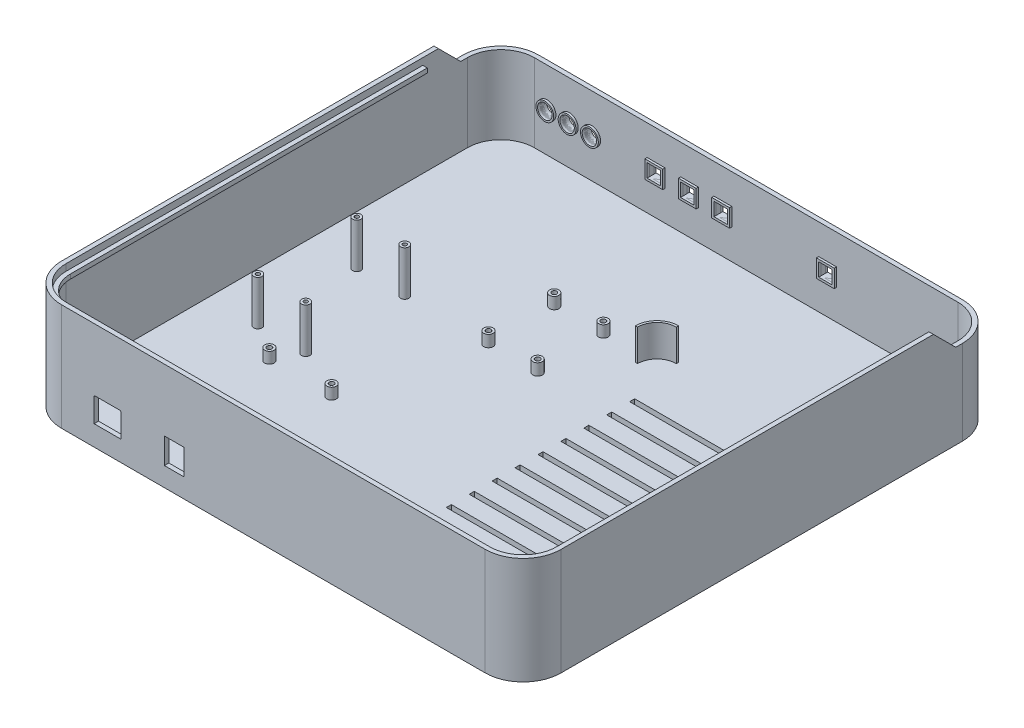
from build123d import *

# Parameters (mm, degrees)
BOSS_EXTRU_1_DEPTH                = 45
BOSS_EXTRU_1_DEPTH_BACK           = 5
COQUE2_START                      = -121.931407942
COQUE2_OUTLINE_W                  = 220
COQUE2_OUTLINE_H                  = 50
COQUE2_DEPTH                      = 180
COQUE2_2_DEPTH                    = 180
COQUE2_START_2                    = -5
COQUE2_3_DEPTH                    = 50
COQUE2_START_3                    = -6
COQUE2_4_DEPTH                    = 51
COQUE2_5_DEPTH                    = 1
FIXATIONS_BATTERIE_12V_DEPTH      = 14.2
FIXATIONS_BATTERIE_12V_2_DEPTH    = 14.2
MODULE_WIFI_R                     = 1.875
MODULE_WIFI_R_2                   = 1.375
MODULE_WIFI_R_3                   = 0.875
INSERTS_MODULE_WIFI_DEPTH         = 20
RELAI_5V_R                        = 1.6
RELAI_5V_R_2                      = 1.102718953
INSERTS_RELAI_DEPTH               = 5.2
BATTERY_9V_R                      = 1.167497876
BATTERY_9V_R_2                    = 0.679581055
BATTERY_9V_R_3                    = 0.194582979
INSERTS_BATTERIE_9V_DEPTH         = 4.5
ARDUINO_SKETCH_R                  = 2.1
ARDUINO_SKETCH_R_2                = 1.6
ARDUINO_SKETCH_R_3                = 1.100535431
ARDUINO_SKETCH_R_4                = 1.1
ARDUINO_SKETCH_R_5                = 1.097252716
ARDUINO_SKETCH_R_6                = 1.102873252
INSERTS_ARDUINO_DEPTH             = 5
EXTRUSION_DEL_ARRIERE_DEPTH       = 5
ESQUISSE21_R                      = 3.25
ENLEVEMENT_DE_MATIERE_LED_DEPTH   = 2
ESQUISSE21_9_W                    = 6
ESQUISSE21_9_H                    = 6
ENLEVEMENT_DE_MATIERE_JACK_DEPTH  = 2
EXTRUSION_FACE_AVANT_DEPTH        = 1
EXTRUSION_FACE_AVANT_DEPTH_BACK   = 3
ESQUISSE21_10_R                   = 4
ESQUISSE21_10_R_2                 = 3.25
EXTRUSION_FACE_AVANT_2_DEPTH      = 1
EXTRUSION_FACE_AVANT_2_DEPTH_BACK = 3
EXTRUSION_FACE_AVANT_3_DEPTH      = 1
EXTRUSION_FACE_AVANT_3_DEPTH_BACK = 3
EXTRUSION_FACE_AVANT_4_DEPTH      = 1
EXTRUSION_FACE_AVANT_4_DEPTH_BACK = 3
ESQUISSE21_10_W                   = 8
ESQUISSE21_10_H                   = 8
ESQUISSE21_10_W_2                 = 6
ESQUISSE21_10_H_2                 = 6
EXTRUSION_FACE_AVANT_5_DEPTH      = 1
EXTRUSION_FACE_AVANT_5_DEPTH_BACK = 3
EXTRUSION_FACE_AVANT_6_DEPTH      = 1
EXTRUSION_FACE_AVANT_6_DEPTH_BACK = 3
EXTRUSION_FACE_AVANT_7_DEPTH      = 1
EXTRUSION_FACE_AVANT_7_DEPTH_BACK = 3
ESQUISSE21_13_W                   = 6
ESQUISSE21_13_H                   = 6
EXTRUSION_JACK_POMPE_DEPTH        = 11
EXTRUSION_SOL_DEPTH               = 5
ESQUISSE25_W                      = 230.656922239
ESQUISSE25_H                      = 84.462187615
BOITIER_D_COUPAGE_FRONTAL_DEPTH   = 11
BOSS_EXTRU_18_DEPTH               = 2
CHANFREIN_START                   = 108.845942394
CHANFREIN_TOP_GAUCHE_OUTLINE_W    = 2
CHANFREIN_TOP_GAUCHE_OUTLINE_H    = 14.142135623
CHANFREIN_TOP_GAUCHE_DEPTH        = 8.154057606
CHANFREIN_TOP_DROIT_OUTLINE_W     = 2
CHANFREIN_TOP_DROIT_OUTLINE_H     = 14.142135623
CHANFREIN_TOP_DROIT_DEPTH         = 8.154057606
ESQUISSE32_W                      = 311.165713488
ESQUISSE32_H                      = 360.537932316
ENL_V_MAT_EXTRU_2_DEPTH           = 10
BATTERY_12V_4_W                   = 65
BATTERY_12V_4_H                   = 2.252560355
BOSS_EXTRU_19_DEPTH               = 2
BATTERY_12V_5_W                   = 65
BATTERY_12V_5_H                   = 2.252560355
ENL_V_MAT_EXTRU_3_DEPTH           = 3


with BuildPart() as part:
    # coque externe → Boss.-Extru.1 (new, two sides: drawn at the far end of the back side and taken through both)
    with BuildSketch(Plane(origin=(0, 0, 0), x_dir=(1, 0, 0), z_dir=(0, 1, 0)).offset(-BOSS_EXTRU_1_DEPTH_BACK)):
        with BuildLine():
            Line((-104.440433213, 121.931407942), (-104.440433213, -58.068592058))
            ThreePointArc((-104.440433213, -58.068592058), (-100.047034931, -68.675193776), (-89.440433213, -73.068592058))
            Line((-89.440433213, -73.068592058), (100.559566787, -73.068592058))
            ThreePointArc((100.559566787, -73.068592058), (111.166168505, -68.675193776), (115.559566787, -58.068592058))
            Line((115.559566787, -58.068592058), (115.559566787, 121.931407942))
            ThreePointArc((115.559566787, 121.931407942), (111.166168505, 132.53800966), (100.559566787, 136.931407942))
            Line((100.559566787, 136.931407942), (-89.440433213, 136.931407942))
            ThreePointArc((-89.440433213, 136.931407942), (-100.047034931, 132.53800966), (-104.440433213, 121.931407942))
        make_face()
    extrude(amount=BOSS_EXTRU_1_DEPTH + BOSS_EXTRU_1_DEPTH_BACK)

    # Coque2: read off the stored shape, not the designer's step
    # Coque2 outline → Coque2 (cut)
    with BuildSketch(Plane.XY.offset(COQUE2_START)):
        with Locations((5.559566787, 20)):
            Rectangle(COQUE2_OUTLINE_W, COQUE2_OUTLINE_H)
    extrude(amount=COQUE2_DEPTH, mode=Mode.SUBTRACT)

    # Coque2 2 outline → Coque2 2 (add)
    with BuildSketch(Plane.XY.offset(COQUE2_START)):
        Polygon((-106.440433213, 45), (-106.440433213, -6), (117.559566787, -6), (117.559566787, 45), (115.559566787, 45), (115.559566787, -5), (-104.440433213, -5), (-104.440433213, 45), align=None)
    extrude(amount=COQUE2_2_DEPTH)

    # Coque2 3 outline → Coque2 3 (cut)
    with BuildSketch(Plane(origin=(0, 0, 0), x_dir=(1, 0, 0), z_dir=(0, 1, 0)).offset(COQUE2_START_2)):
        with BuildLine():
            Line((-104.440433213, 121.931407942), (115.559566787, 121.931407942))
            ThreePointArc((115.559566787, 121.931407942), (111.166168505, 132.53800966), (100.559566787, 136.931407942))
            Line((100.559566787, 136.931407942), (-89.440433213, 136.931407942))
            ThreePointArc((-89.440433213, 136.931407942), (-100.047034931, 132.53800966), (-104.440433213, 121.931407942))
        make_face()
        with BuildLine():
            Line((115.559566787, -58.068592058), (-104.440433213, -58.068592058))
            ThreePointArc((-104.440433213, -58.068592058), (-100.047034931, -68.675193776), (-89.440433213, -73.068592058))
            Line((-89.440433213, -73.068592058), (100.559566787, -73.068592058))
            ThreePointArc((100.559566787, -73.068592058), (111.166168505, -68.675193776), (115.559566787, -58.068592058))
        make_face()
    extrude(amount=COQUE2_3_DEPTH, mode=Mode.SUBTRACT)

    # Coque2 4 outline → Coque2 4 (add)
    with BuildSketch(Plane(origin=(0, 0, 0), x_dir=(1, 0, 0), z_dir=(0, 1, 0)).offset(COQUE2_START_3)):
        with BuildLine():
            ThreePointArc((117.559566787, 121.931407942), (112.580382067, 133.952223222), (100.559566787, 138.931407942))
            Line((100.559566787, 138.931407942), (-89.440433213, 138.931407942))
            ThreePointArc((-89.440433213, 138.931407942), (-101.461248493, 133.952223222), (-106.440433213, 121.931407942))
            Line((-106.440433213, 121.931407942), (-104.440433213, 121.931407942))
            ThreePointArc((-104.440433213, 121.931407942), (-100.047034931, 132.53800966), (-89.440433213, 136.931407942))
            Line((-89.440433213, 136.931407942), (100.559566787, 136.931407942))
            ThreePointArc((100.559566787, 136.931407942), (111.166168505, 132.53800966), (115.559566787, 121.931407942))
            Line((115.559566787, 121.931407942), (117.559566787, 121.931407942))
        make_face()
        with BuildLine():
            ThreePointArc((-106.440433213, -58.068592058), (-101.461248493, -70.089407338), (-89.440433213, -75.068592058))
            Line((-89.440433213, -75.068592058), (100.559566787, -75.068592058))
            ThreePointArc((100.559566787, -75.068592058), (112.580382067, -70.089407338), (117.559566787, -58.068592058))
            Line((117.559566787, -58.068592058), (115.559566787, -58.068592058))
            ThreePointArc((115.559566787, -58.068592058), (111.166168505, -68.675193776), (100.559566787, -73.068592058))
            Line((100.559566787, -73.068592058), (-89.440433213, -73.068592058))
            ThreePointArc((-89.440433213, -73.068592058), (-100.047034931, -68.675193776), (-104.440433213, -58.068592058))
            Line((-104.440433213, -58.068592058), (-106.440433213, -58.068592058))
        make_face()
    extrude(amount=COQUE2_4_DEPTH)

    # Coque2 5 outline → Coque2 5 (add)
    with BuildSketch(Plane(origin=(0, 0, 0), x_dir=(1, 0, 0), z_dir=(0, 1, 0)).offset(COQUE2_START_3)):
        with BuildLine():
            Line((-104.440433213, 121.931407942), (115.559566787, 121.931407942))
            ThreePointArc((115.559566787, 121.931407942), (111.166168505, 132.53800966), (100.559566787, 136.931407942))
            Line((100.559566787, 136.931407942), (-89.440433213, 136.931407942))
            ThreePointArc((-89.440433213, 136.931407942), (-100.047034931, 132.53800966), (-104.440433213, 121.931407942))
        make_face()
        with BuildLine():
            Line((115.559566787, -58.068592058), (-104.440433213, -58.068592058))
            ThreePointArc((-104.440433213, -58.068592058), (-100.047034931, -68.675193776), (-89.440433213, -73.068592058))
            Line((-89.440433213, -73.068592058), (100.559566787, -73.068592058))
            ThreePointArc((100.559566787, -73.068592058), (111.166168505, -68.675193776), (115.559566787, -58.068592058))
        make_face()
    extrude(amount=COQUE2_5_DEPTH)

    # Esquisse17 → Extrusion del arriere (cut)
    with BuildSketch(Plane(origin=(0, 0, 73.068592058), x_dir=(-1, 0, 0), z_dir=(0, 0, -1))):
        with BuildLine():
            Line((74.840433213, 6.1), (74.840433213, 8.6))
            Line((74.840433213, 8.6), (74.840433213, 16.6))
            ThreePointArc((74.840433213, 16.6), (74.693986604, 16.953553391), (74.340433213, 17.1))
            Line((74.340433213, 17.1), (63.340433213, 17.1))
            ThreePointArc((63.340433213, 17.1), (62.986879822, 16.953553391), (62.840433213, 16.6))
            Line((62.840433213, 16.6), (62.840433213, 7.1))
            Line((62.840433213, 7.1), (62.840433213, 6.6))
            Line((62.840433213, 6.6), (62.840433213, 6.1))
            Line((62.840433213, 6.1), (62.991727866, 6.1))
            Line((62.991727866, 6.1), (74.840433213, 6.1))
        make_face()
        Polygon((34.440433213, 5.6), (43.340433213, 5.6), (43.340433213, 6.6), (43.340433213, 17.1), (34.440433213, 17.1), (34.440433213, 14.6), align=None)
    extrude(amount=-EXTRUSION_DEL_ARRIERE_DEPTH, mode=Mode.SUBTRACT)

    # Esquisse21 → enlevement de matiere LED (cut)
    with BuildSketch(Plane(origin=(0, 0, -138.931407942), x_dir=(-1, 0, 0), z_dir=(0, 0, -1))):
        with Locations((83.728483512, 17.5)):
            Circle(ESQUISSE21_R)
        with Locations((73.728483512, 17.5)):
            Circle(ESQUISSE21_R)
        with Locations((63.728483512, 17.5)):
            Circle(ESQUISSE21_R)
    extrude(amount=-ENLEVEMENT_DE_MATIERE_LED_DEPTH, mode=Mode.SUBTRACT)

    # Esquisse21<9> → enlevement de matiere Jack (cut)
    with BuildSketch(Plane(origin=(0, 0, -138.931407942), x_dir=(-1, 0, 0), z_dir=(0, 0, -1))):
        with Locations((34.837391364, 17.5)):
            Rectangle(ESQUISSE21_9_W, ESQUISSE21_9_H)
        with Locations((19.856363742, 17.5)):
            Rectangle(ESQUISSE21_9_W, ESQUISSE21_9_H)
        with Locations((4.87533612, 17.5)):
            Rectangle(ESQUISSE21_9_W, ESQUISSE21_9_H)
    extrude(amount=-ENLEVEMENT_DE_MATIERE_JACK_DEPTH, mode=Mode.SUBTRACT)

    # Esquisse21<13> → Extrusion jack pompe (cut)
    with BuildSketch(Plane(origin=(0, 0, -138.931407942), x_dir=(-1, 0, 0), z_dir=(0, 0, -1))):
        with Locations((-42.12466388, 17.5)):
            Rectangle(ESQUISSE21_13_W, ESQUISSE21_13_H)
    extrude(amount=-EXTRUSION_JACK_POMPE_DEPTH, mode=Mode.SUBTRACT)



with BuildPart() as body_2:
    # battery 12V → fixations batterie 12V (new body)
    with BuildSketch(Plane(origin=(0, 0, 0), x_dir=(-1, 0, 0), z_dir=(0, 1, 0))):
        with BuildLine():
            ThreePointArc((-26.274566787, -84.931407942), (-20.112131189, -82.37884354), (-17.559566787, -76.216407942))
            Line((-17.559566787, -76.216407942), (-16.559566787, -76.216407942))
            ThreePointArc((-16.559566787, -76.216407942), (-19.405024408, -83.085950321), (-26.274566787, -85.931407942))
            Line((-26.274566787, -85.931407942), (-26.274566787, -84.931407942))
        make_face()
    extrude(amount=FIXATIONS_BATTERIE_12V_DEPTH)


with BuildPart() as body_3:
    # battery 12V → fixations batterie 12V 2 (new body)
    with BuildSketch(Plane(origin=(0, 0, 0), x_dir=(-1, 0, 0), z_dir=(0, 1, 0))):
        with BuildLine():
            ThreePointArc((-99.844566787, 66.068592058), (-106.007002385, 63.516027656), (-108.559566787, 57.353592058))
            Line((-108.559566787, 57.353592058), (-109.559566787, 57.353592058))
            ThreePointArc((-109.559566787, 57.353592058), (-106.714109166, 64.223134437), (-99.844566787, 67.068592058))
            Line((-99.844566787, 67.068592058), (-99.844566787, 66.068592058))
        make_face()
    extrude(amount=FIXATIONS_BATTERIE_12V_2_DEPTH)


with BuildPart() as body_4:
    # Module Wifi → Inserts module wifi (new body)
    # profile 1 of 8: a face of its own
    with BuildSketch(Plane(origin=(0, 0, 0), x_dir=(1, 0, 0), z_dir=(0, 1, 0))):
        with Locations(Location((-82.398224582, 5.894456898, 0), (0, 0, 270))):
            Circle(MODULE_WIFI_R)
        with Locations((-82.398224582, 5.894456898)):
            Circle(MODULE_WIFI_R_2, mode=Mode.SUBTRACT)
    # profile 2 of 8: a face of its own
    with BuildSketch(Plane(origin=(0, 0, 0), x_dir=(1, 0, 0), z_dir=(0, 1, 0))):
        with Locations((-82.398224582, 5.894456898)):
            Circle(MODULE_WIFI_R_2)
        with Locations(Location((-82.398224582, 5.894456898, 0), (0, 0, 270))):
            Circle(MODULE_WIFI_R_3, mode=Mode.SUBTRACT)
    # profile 3 of 8: a face of its own
    with BuildSketch(Plane(origin=(0, 0, 0), x_dir=(1, 0, 0), z_dir=(0, 1, 0))):
        with Locations(Location((-60.940433213, 5.931407942, 0), (0, 0, 270))):
            Circle(MODULE_WIFI_R)
        with Locations((-60.940433213, 5.931407942)):
            Circle(MODULE_WIFI_R_2, mode=Mode.SUBTRACT)
    # profile 4 of 8: a face of its own
    with BuildSketch(Plane(origin=(0, 0, 0), x_dir=(1, 0, 0), z_dir=(0, 1, 0))):
        with Locations((-60.940433213, 5.931407942)):
            Circle(MODULE_WIFI_R_2)
        with Locations(Location((-60.940433213, 5.931407942, 0), (0, 0, 270))):
            Circle(MODULE_WIFI_R_3, mode=Mode.SUBTRACT)
    # profile 5 of 8: a face of its own
    with BuildSketch(Plane(origin=(0, 0, 0), x_dir=(1, 0, 0), z_dir=(0, 1, 0))):
        with Locations(Location((-60.940433213, 50.331407942, 0), (0, 0, 270))):
            Circle(MODULE_WIFI_R)
        with Locations((-60.940433213, 50.331407942)):
            Circle(MODULE_WIFI_R_2, mode=Mode.SUBTRACT)
    # profile 6 of 8: a face of its own
    with BuildSketch(Plane(origin=(0, 0, 0), x_dir=(1, 0, 0), z_dir=(0, 1, 0))):
        with Locations((-60.940433213, 50.331407942)):
            Circle(MODULE_WIFI_R_2)
        with Locations(Location((-60.940433213, 50.331407942, 0), (0, 0, 270))):
            Circle(MODULE_WIFI_R_3, mode=Mode.SUBTRACT)
    # profile 7 of 8: a face of its own
    with BuildSketch(Plane(origin=(0, 0, 0), x_dir=(1, 0, 0), z_dir=(0, 1, 0))):
        with Locations(Location((-82.440433213, 50.331407942, 0), (0, 0, 270))):
            Circle(MODULE_WIFI_R)
        with Locations((-82.440433213, 50.331407942)):
            Circle(MODULE_WIFI_R_2, mode=Mode.SUBTRACT)
    # profile 8 of 8: a face of its own
    with BuildSketch(Plane(origin=(0, 0, 0), x_dir=(1, 0, 0), z_dir=(0, 1, 0))):
        with Locations((-82.440433213, 50.331407942)):
            Circle(MODULE_WIFI_R_2)
        with Locations(Location((-82.440433213, 50.331407942, 0), (0, 0, 270))):
            Circle(MODULE_WIFI_R_3, mode=Mode.SUBTRACT)
    extrude(amount=INSERTS_MODULE_WIFI_DEPTH)


with BuildPart() as body_5:
    # Relai 5V → Inserts Relai (new body)
    # profile 1 of 16: a face of its own
    with BuildSketch(Plane(origin=(0, 0, 0), x_dir=(-1, 0, 0), z_dir=(0, 1, 0))):
        with BuildLine():
            Line((0.800120789, -81.931407942), (2.080745637, -81.931407942))
            ThreePointArc((2.080745637, -81.931407942), (3.136702073, -81.169419233), (3.540433213, -79.931407942))
            ThreePointArc((3.540433213, -79.931407942), (1.764470248, -77.85655855), (-0.559566787, -79.291095518))
            Line((-0.559566787, -79.291095518), (-0.559566787, -80.571720366))
            ThreePointArc((-0.559566787, -80.571720366), (-0.044491027, -81.416332183), (0.800120789, -81.931407942))
        make_face()
        with Locations((1.440433213, -79.931407942)):
            Circle(RELAI_5V_R, mode=Mode.SUBTRACT)
    # profile 2 of 16: a face of its own
    with BuildSketch(Plane(origin=(0, 0, 0), x_dir=(-1, 0, 0), z_dir=(0, 1, 0))):
        with Locations((1.440433213, -79.931407942)):
            Circle(RELAI_5V_R)
        with Locations(Location((1.440433213, -79.931407942, 0), (0, 0, 90))):
            Circle(RELAI_5V_R_2, mode=Mode.SUBTRACT)
    # profile 3 of 16: a face of its own
    with BuildSketch(Plane(origin=(0, 0, 0), x_dir=(-1, 0, 0), z_dir=(0, 1, 0))):
        with BuildLine():
            Line((25.490433213, -80.571720366), (25.490433213, -79.291095518))
            ThreePointArc((25.490433213, -79.291095518), (22.005508973, -78.446483702), (22.850120789, -81.931407942))
            Line((22.850120789, -81.931407942), (24.130745637, -81.931407942))
            ThreePointArc((24.130745637, -81.931407942), (24.975357453, -81.416332183), (25.490433213, -80.571720366))
        make_face()
        with Locations((23.490433213, -79.931407942)):
            Circle(RELAI_5V_R, mode=Mode.SUBTRACT)
    # profile 4 of 16: a face of its own
    with BuildSketch(Plane(origin=(0, 0, 0), x_dir=(-1, 0, 0), z_dir=(0, 1, 0))):
        with Locations((23.490433213, -79.931407942)):
            Circle(RELAI_5V_R)
        with Locations(Location((23.490433213, -79.931407942, 0), (0, 0, 90))):
            Circle(RELAI_5V_R_2, mode=Mode.SUBTRACT)
    # profile 5 of 16: a face of its own
    with BuildSketch(Plane(origin=(0, 0, 0), x_dir=(-1, 0, 0), z_dir=(0, 1, 0))):
        with BuildLine():
            Line((25.490433213, -51.071720366), (25.490433213, -49.791095518))
            ThreePointArc((25.490433213, -49.791095518), (24.975357453, -48.946483702), (24.130745637, -48.431407942))
            Line((24.130745637, -48.431407942), (22.850120789, -48.431407942))
            ThreePointArc((22.850120789, -48.431407942), (22.005508973, -51.916332183), (25.490433213, -51.071720366))
        make_face()
        with Locations((23.490433213, -50.431407942)):
            Circle(RELAI_5V_R, mode=Mode.SUBTRACT)
    # profile 6 of 16: a face of its own
    with BuildSketch(Plane(origin=(0, 0, 0), x_dir=(-1, 0, 0), z_dir=(0, 1, 0))):
        with Locations((23.490433213, -50.431407942)):
            Circle(RELAI_5V_R)
        with Locations(Location((23.490433213, -50.431407942, 0), (0, 0, 90))):
            Circle(RELAI_5V_R_2, mode=Mode.SUBTRACT)
    # profile 7 of 16: a face of its own
    with BuildSketch(Plane(origin=(0, 0, 0), x_dir=(-1, 0, 0), z_dir=(0, 1, 0))):
        with BuildLine():
            ThreePointArc((3.540433213, -50.431407942), (3.136702073, -49.193396652), (2.080745637, -48.431407942))
            Line((2.080745637, -48.431407942), (0.800120789, -48.431407942))
            ThreePointArc((0.800120789, -48.431407942), (-0.044491027, -48.946483702), (-0.559566787, -49.791095518))
            Line((-0.559566787, -49.791095518), (-0.559566787, -51.071720366))
            ThreePointArc((-0.559566787, -51.071720366), (1.764470248, -52.506257334), (3.540433213, -50.431407942))
        make_face()
        with Locations((1.440433213, -50.431407942)):
            Circle(RELAI_5V_R, mode=Mode.SUBTRACT)
    # profile 8 of 16: a face of its own
    with BuildSketch(Plane(origin=(0, 0, 0), x_dir=(-1, 0, 0), z_dir=(0, 1, 0))):
        with Locations((1.440433213, -50.431407942)):
            Circle(RELAI_5V_R)
        with Locations(Location((1.440433213, -50.431407942, 0), (0, 0, 90))):
            Circle(RELAI_5V_R_2, mode=Mode.SUBTRACT)
    # profile 9 of 16: a face of its own
    with BuildSketch(Plane(origin=(0, 0, 0), x_dir=(-1, 0, 0), z_dir=(0, 1, 0))):
        with BuildLine():
            Line((-0.559566787, -80.571720366), (-0.559566787, -79.291095518))
            ThreePointArc((-0.559566787, -79.291095518), (-0.659566787, -79.931407942), (-0.559566787, -80.571720366))
        make_face()
    # profile 10 of 16: a face of its own
    with BuildSketch(Plane(origin=(0, 0, 0), x_dir=(-1, 0, 0), z_dir=(0, 1, 0))):
        with BuildLine():
            ThreePointArc((0.800120789, -81.931407942), (1.440433213, -82.031407942), (2.080745637, -81.931407942))
            Line((2.080745637, -81.931407942), (0.800120789, -81.931407942))
        make_face()
    # profile 11 of 16: a face of its own
    with BuildSketch(Plane(origin=(0, 0, 0), x_dir=(-1, 0, 0), z_dir=(0, 1, 0))):
        with BuildLine():
            ThreePointArc((25.590433213, -79.931407942), (25.565282605, -79.607370907), (25.490433213, -79.291095518))
            Line((25.490433213, -79.291095518), (25.490433213, -80.571720366))
            ThreePointArc((25.490433213, -80.571720366), (25.565282605, -80.255444977), (25.590433213, -79.931407942))
        make_face()
    # profile 12 of 16: a face of its own
    with BuildSketch(Plane(origin=(0, 0, 0), x_dir=(-1, 0, 0), z_dir=(0, 1, 0))):
        with BuildLine():
            Line((24.130745637, -81.931407942), (22.850120789, -81.931407942))
            ThreePointArc((22.850120789, -81.931407942), (23.490433213, -82.031407942), (24.130745637, -81.931407942))
        make_face()
    # profile 13 of 16: a face of its own
    with BuildSketch(Plane(origin=(0, 0, 0), x_dir=(-1, 0, 0), z_dir=(0, 1, 0))):
        with BuildLine():
            ThreePointArc((25.590433213, -50.431407942), (25.565282605, -50.107370907), (25.490433213, -49.791095518))
            Line((25.490433213, -49.791095518), (25.490433213, -51.071720366))
            ThreePointArc((25.490433213, -51.071720366), (25.565282605, -50.755444977), (25.590433213, -50.431407942))
        make_face()
    # profile 14 of 16: a face of its own
    with BuildSketch(Plane(origin=(0, 0, 0), x_dir=(-1, 0, 0), z_dir=(0, 1, 0))):
        with BuildLine():
            Line((22.850120789, -48.431407942), (24.130745637, -48.431407942))
            ThreePointArc((24.130745637, -48.431407942), (23.490433213, -48.331407942), (22.850120789, -48.431407942))
        make_face()
    # profile 15 of 16: a face of its own
    with BuildSketch(Plane(origin=(0, 0, 0), x_dir=(-1, 0, 0), z_dir=(0, 1, 0))):
        with BuildLine():
            Line((-0.559566787, -51.071720366), (-0.559566787, -49.791095518))
            ThreePointArc((-0.559566787, -49.791095518), (-0.659566787, -50.431407942), (-0.559566787, -51.071720366))
        make_face()
    # profile 16 of 16: a face of its own
    with BuildSketch(Plane(origin=(0, 0, 0), x_dir=(-1, 0, 0), z_dir=(0, 1, 0))):
        with BuildLine():
            Line((0.800120789, -48.431407942), (2.080745637, -48.431407942))
            ThreePointArc((2.080745637, -48.431407942), (1.440433213, -48.331407942), (0.800120789, -48.431407942))
        make_face()
    extrude(amount=INSERTS_RELAI_DEPTH)


with BuildPart() as body_6:
    # battery 9V → Inserts batterie 9V (new body)
    # profile 1 of 4: a face of its own
    with BuildSketch(Plane(origin=(0, 0, 0), x_dir=(1, 0, 0), z_dir=(0, 1, 0))):
        with Locations(Location((-13.582829551, -48.772255874, 0), (0, 0, 270))):
            Circle(BATTERY_9V_R)
        with Locations((-13.582829551, -48.772255874)):
            Circle(BATTERY_9V_R_2, mode=Mode.SUBTRACT)
    # profile 2 of 4: a face of its own
    with BuildSketch(Plane(origin=(0, 0, 0), x_dir=(1, 0, 0), z_dir=(0, 1, 0))):
        with Locations((-13.582829551, -48.772255874)):
            Circle(BATTERY_9V_R_2)
        with Locations(Location((-13.582829551, -48.772255874, 0), (0, 0, 270))):
            Circle(BATTERY_9V_R_3, mode=Mode.SUBTRACT)
    # profile 3 of 4: a face of its own
    with BuildSketch(Plane(origin=(0, 0, 0), x_dir=(1, 0, 0), z_dir=(0, 1, 0))):
        with Locations(Location((7.82129817, -35.637904773, 0), (0, 0, 270))):
            Circle(BATTERY_9V_R)
        with Locations((7.82129817, -35.637904773)):
            Circle(BATTERY_9V_R_2, mode=Mode.SUBTRACT)
    # profile 4 of 4: a face of its own
    with BuildSketch(Plane(origin=(0, 0, 0), x_dir=(1, 0, 0), z_dir=(0, 1, 0))):
        with Locations((7.82129817, -35.637904773)):
            Circle(BATTERY_9V_R_2)
        with Locations(Location((7.82129817, -35.637904773, 0), (0, 0, 270))):
            Circle(BATTERY_9V_R_3, mode=Mode.SUBTRACT)
    extrude(amount=INSERTS_BATTERIE_9V_DEPTH)


with BuildPart() as body_7:
    # Arduino Sketch → Inserts arduino (new body)
    # profile 1 of 8: a face of its own
    with BuildSketch(Plane(origin=(-115.580866426, 0, -79.737184116), x_dir=(1, 0, 0), z_dir=(0, 1, 0))):
        with Locations(Location((49.340433213, -84.805776173, 0), (0, 0, 270))):
            Circle(ARDUINO_SKETCH_R)
        with Locations((49.340433213, -84.805776173)):
            Circle(ARDUINO_SKETCH_R_2, mode=Mode.SUBTRACT)
    # profile 2 of 8: a face of its own
    with BuildSketch(Plane(origin=(-115.580866426, 0, -79.737184116), x_dir=(1, 0, 0), z_dir=(0, 1, 0))):
        with Locations((49.340433213, -84.805776173)):
            Circle(ARDUINO_SKETCH_R_2)
        with Locations(Location((49.340433213, -84.805776173, 0), (0, 0, 270))):
            Circle(ARDUINO_SKETCH_R_3, mode=Mode.SUBTRACT)
    # profile 3 of 8: a face of its own
    with BuildSketch(Plane(origin=(-115.580866426, 0, -79.737184116), x_dir=(1, 0, 0), z_dir=(0, 1, 0))):
        with Locations(Location((77.240433213, -84.805776173, 0), (0, 0, 270))):
            Circle(ARDUINO_SKETCH_R)
        with Locations((77.240433213, -84.805776173)):
            Circle(ARDUINO_SKETCH_R_2, mode=Mode.SUBTRACT)
    # profile 4 of 8: a face of its own
    with BuildSketch(Plane(origin=(-115.580866426, 0, -79.737184116), x_dir=(1, 0, 0), z_dir=(0, 1, 0))):
        with Locations((77.240433213, -84.805776173)):
            Circle(ARDUINO_SKETCH_R_2)
        with Locations(Location((77.240433213, -84.805776173, 0), (0, 0, 270))):
            Circle(ARDUINO_SKETCH_R_4, mode=Mode.SUBTRACT)
    # profile 5 of 8: a face of its own
    with BuildSketch(Plane(origin=(-115.580866426, 0, -79.737184116), x_dir=(1, 0, 0), z_dir=(0, 1, 0))):
        with Locations(Location((81.940433213, -136.705776173, 0), (0, 0, 270))):
            Circle(ARDUINO_SKETCH_R)
        with Locations((81.940433213, -136.705776173)):
            Circle(ARDUINO_SKETCH_R_2, mode=Mode.SUBTRACT)
    # profile 6 of 8: a face of its own
    with BuildSketch(Plane(origin=(-115.580866426, 0, -79.737184116), x_dir=(1, 0, 0), z_dir=(0, 1, 0))):
        with Locations((81.940433213, -136.705776173)):
            Circle(ARDUINO_SKETCH_R_2)
        with Locations(Location((81.940433213, -136.705776173, 0), (0, 0, 270))):
            Circle(ARDUINO_SKETCH_R_5, mode=Mode.SUBTRACT)
    # profile 7 of 8: a face of its own
    with BuildSketch(Plane(origin=(-115.580866426, 0, -79.737184116), x_dir=(1, 0, 0), z_dir=(0, 1, 0))):
        with Locations(Location((34.140433213, -135.605776173, 0), (0, 0, 270))):
            Circle(ARDUINO_SKETCH_R)
        with Locations((34.140433213, -135.605776173)):
            Circle(ARDUINO_SKETCH_R_2, mode=Mode.SUBTRACT)
    # profile 8 of 8: a face of its own
    with BuildSketch(Plane(origin=(-115.580866426, 0, -79.737184116), x_dir=(1, 0, 0), z_dir=(0, 1, 0))):
        with Locations((34.140433213, -135.605776173)):
            Circle(ARDUINO_SKETCH_R_2)
        with Locations(Location((34.140433213, -135.605776173, 0), (0, 0, 270))):
            Circle(ARDUINO_SKETCH_R_6, mode=Mode.SUBTRACT)
    extrude(amount=INSERTS_ARDUINO_DEPTH)


with BuildPart() as body_8:
    # Esquisse21<10> → Extrusion face avant (new, two sides: drawn at the far end of the back side and taken through both)
    with BuildSketch(Plane(origin=(0, 0, -138.931407942), x_dir=(-1, 0, 0), z_dir=(0, 0, -1)).offset(-EXTRUSION_FACE_AVANT_DEPTH_BACK)):
        with Locations((83.728483512, 17.5)):
            Circle(ESQUISSE21_10_R)
        with Locations((83.728483512, 17.5)):
            Circle(ESQUISSE21_10_R_2, mode=Mode.SUBTRACT)
    extrude(amount=EXTRUSION_FACE_AVANT_DEPTH + EXTRUSION_FACE_AVANT_DEPTH_BACK)


with BuildPart() as body_9:
    # Esquisse21<10> → Extrusion face avant 2 (new, two sides: drawn at the far end of the back side and taken through both)
    with BuildSketch(Plane(origin=(0, 0, -138.931407942), x_dir=(-1, 0, 0), z_dir=(0, 0, -1)).offset(-EXTRUSION_FACE_AVANT_2_DEPTH_BACK)):
        with Locations((73.728483512, 17.5)):
            Circle(ESQUISSE21_10_R)
        with Locations((73.728483512, 17.5)):
            Circle(ESQUISSE21_10_R_2, mode=Mode.SUBTRACT)
    extrude(amount=EXTRUSION_FACE_AVANT_2_DEPTH + EXTRUSION_FACE_AVANT_2_DEPTH_BACK)


with BuildPart() as body_10:
    # Esquisse21<10> → Extrusion face avant 3 (new, two sides: drawn at the far end of the back side and taken through both)
    with BuildSketch(Plane(origin=(0, 0, -138.931407942), x_dir=(-1, 0, 0), z_dir=(0, 0, -1)).offset(-EXTRUSION_FACE_AVANT_3_DEPTH_BACK)):
        with Locations((63.728483512, 17.5)):
            Circle(ESQUISSE21_10_R)
        with Locations((63.728483512, 17.5)):
            Circle(ESQUISSE21_10_R_2, mode=Mode.SUBTRACT)
    extrude(amount=EXTRUSION_FACE_AVANT_3_DEPTH + EXTRUSION_FACE_AVANT_3_DEPTH_BACK)


with BuildPart() as body_11:
    # Esquisse21<10> → Extrusion face avant 4 (new, two sides: drawn at the far end of the back side and taken through both)
    with BuildSketch(Plane(origin=(0, 0, -138.931407942), x_dir=(-1, 0, 0), z_dir=(0, 0, -1)).offset(-EXTRUSION_FACE_AVANT_4_DEPTH_BACK)):
        with Locations((19.856363742, 17.5)):
            Rectangle(ESQUISSE21_10_W, ESQUISSE21_10_H)
        with Locations((19.856363742, 17.5)):
            Rectangle(ESQUISSE21_10_W_2, ESQUISSE21_10_H_2, mode=Mode.SUBTRACT)
    extrude(amount=EXTRUSION_FACE_AVANT_4_DEPTH + EXTRUSION_FACE_AVANT_4_DEPTH_BACK)


with BuildPart() as body_12:
    # Esquisse21<10> → Extrusion face avant 5 (new, two sides: drawn at the far end of the back side and taken through both)
    with BuildSketch(Plane(origin=(0, 0, -138.931407942), x_dir=(-1, 0, 0), z_dir=(0, 0, -1)).offset(-EXTRUSION_FACE_AVANT_5_DEPTH_BACK)):
        with Locations((34.837391364, 17.5)):
            Rectangle(ESQUISSE21_10_W, ESQUISSE21_10_H)
        with Locations((34.837391364, 17.5)):
            Rectangle(ESQUISSE21_10_W_2, ESQUISSE21_10_H_2, mode=Mode.SUBTRACT)
    extrude(amount=EXTRUSION_FACE_AVANT_5_DEPTH + EXTRUSION_FACE_AVANT_5_DEPTH_BACK)


with BuildPart() as body_13:
    # Esquisse21<10> → Extrusion face avant 6 (new, two sides: drawn at the far end of the back side and taken through both)
    with BuildSketch(Plane(origin=(0, 0, -138.931407942), x_dir=(-1, 0, 0), z_dir=(0, 0, -1)).offset(-EXTRUSION_FACE_AVANT_6_DEPTH_BACK)):
        with Locations((4.87533612, 17.5)):
            Rectangle(ESQUISSE21_10_W, ESQUISSE21_10_H)
        with Locations((4.87533612, 17.5)):
            Rectangle(ESQUISSE21_10_W_2, ESQUISSE21_10_H_2, mode=Mode.SUBTRACT)
    extrude(amount=EXTRUSION_FACE_AVANT_6_DEPTH + EXTRUSION_FACE_AVANT_6_DEPTH_BACK)


with BuildPart() as body_14:
    # Esquisse21<10> → Extrusion face avant 7 (new, two sides: drawn at the far end of the back side and taken through both)
    with BuildSketch(Plane(origin=(0, 0, -138.931407942), x_dir=(-1, 0, 0), z_dir=(0, 0, -1)).offset(-EXTRUSION_FACE_AVANT_7_DEPTH_BACK)):
        with Locations((-42.12466388, 17.5)):
            Rectangle(ESQUISSE21_10_W, ESQUISSE21_10_H)
        with Locations((-42.12466388, 17.5)):
            Rectangle(ESQUISSE21_10_W_2, ESQUISSE21_10_H_2, mode=Mode.SUBTRACT)
    extrude(amount=EXTRUSION_FACE_AVANT_7_DEPTH + EXTRUSION_FACE_AVANT_7_DEPTH_BACK)


with BuildPart() as part_1:
    add(part.part)

    add(body_2.part)  # Extrusion sol merges body 2

    add(body_3.part)  # Extrusion sol merges body 3

    add(body_4.part)  # Extrusion sol merges body 4

    add(body_5.part)  # Extrusion sol merges body 5

    add(body_6.part)  # Extrusion sol merges body 6

    add(body_7.part)  # Extrusion sol merges body 7
    # Esquisse28 → Extrusion sol (add)
    with BuildSketch(Plane(origin=(0, -5, 0), x_dir=(1, 0, 0), z_dir=(0, 1, 0))):
        with BuildLine():
            Line((117.559566787, 121.931407942), (117.559566787, -58.068592058))
            ThreePointArc((117.559566787, -58.068592058), (112.580382067, -70.089407338), (100.559566787, -75.068592058))
            Line((100.559566787, -75.068592058), (-89.440433213, -75.068592058))
            ThreePointArc((-89.440433213, -75.068592058), (-101.461248493, -70.089407338), (-106.440433213, -58.068592058))
            Line((-106.440433213, -58.068592058), (-106.440433213, 121.931407942))
            ThreePointArc((-106.440433213, 121.931407942), (-101.461248493, 133.952223222), (-89.440433213, 138.931407942))
            Line((-89.440433213, 138.931407942), (100.559566787, 138.931407942))
            ThreePointArc((100.559566787, 138.931407942), (112.580382067, 133.952223222), (117.559566787, 121.931407942))
        make_face()
    extrude(amount=EXTRUSION_SOL_DEPTH)

    # Esquisse25 → Boitier découpage frontal (cut)
    with BuildSketch(Plane(origin=(0, 35, 0), x_dir=(1, 0, 0), z_dir=(0, 1, 0))):
        with Locations((5.236736986, 161.16250175)):
            Rectangle(ESQUISSE25_W, ESQUISSE25_H)
    extrude(amount=BOITIER_D_COUPAGE_FRONTAL_DEPTH, mode=Mode.SUBTRACT)

    # Rail interieur → Boss.-Extru.18 (add)
    with BuildSketch(Plane(origin=(0, 40, 0), x_dir=(1, 0, 0), z_dir=(0, 1, 0))):
        with BuildLine():
            Line((-104.440433213, 101.931407942), (-104.440433213, -58.068592058))
            ThreePointArc((-104.440433213, -58.068592058), (-100.047034931, -68.675193776), (-89.440433213, -73.068592058))
            Line((-89.440433213, -73.068592058), (100.559566787, -73.068592058))
            ThreePointArc((100.559566787, -73.068592058), (111.166168505, -68.675193776), (115.559566787, -58.068592058))
            Line((115.559566787, -58.068592058), (115.559566787, 101.931407942))
            Line((115.559566787, 101.931407942), (113.559566787, 101.931407942))
            Line((113.559566787, 101.931407942), (113.559566787, -58.068592058))
            ThreePointArc((113.559566787, -58.068592058), (109.751954942, -67.260980213), (100.559566787, -71.068592058))
            Line((100.559566787, -71.068592058), (-89.440433213, -71.068592058))
            ThreePointArc((-89.440433213, -71.068592058), (-98.632821368, -67.260980213), (-102.440433213, -58.068592058))
            Line((-102.440433213, -58.068592058), (-102.440433213, 101.931407942))
            Line((-102.440433213, 101.931407942), (-104.440433213, 101.931407942))
        make_face()
    extrude(amount=BOSS_EXTRU_18_DEPTH)

    # Chanfrein top gauche: read off the stored shape, not the designer's step
    # Chanfrein top gauche outline → Chanfrein top gauche (cut)
    with BuildSketch(Plane(origin=(0, 0, 0), x_dir=(1, 0, 0), z_dir=(0, 0.707106781186547, -0.707106781186548)).offset(CHANFREIN_START)):
        with Locations((116.559566787, 52.277399899)):
            Rectangle(CHANFREIN_TOP_GAUCHE_OUTLINE_W, CHANFREIN_TOP_GAUCHE_OUTLINE_H)
    extrude(amount=CHANFREIN_TOP_GAUCHE_DEPTH, mode=Mode.SUBTRACT)

    # Chanfrein top droit: read off the stored shape, not the designer's step
    # Chanfrein top droit outline → Chanfrein top droit (cut)
    with BuildSketch(Plane(origin=(0, 0, 0), x_dir=(1, 0, 0), z_dir=(0, 0.707106781186547, -0.707106781186548)).offset(CHANFREIN_START)):
        with Locations((-105.440433213, 52.277399899)):
            Rectangle(CHANFREIN_TOP_DROIT_OUTLINE_W, CHANFREIN_TOP_DROIT_OUTLINE_H)
    extrude(amount=CHANFREIN_TOP_DROIT_DEPTH, mode=Mode.SUBTRACT)

    # Esquisse32 → Enlèv. mat.-Extru.2 (cut)
    with BuildSketch(Plane(origin=(0, -3, 0), x_dir=(-1, 0, 0), z_dir=(0, -1, 0))):
        with Locations((9.363607076, 15.343338424)):
            Rectangle(ESQUISSE32_W, ESQUISSE32_H)
    extrude(amount=ENL_V_MAT_EXTRU_2_DEPTH, mode=Mode.SUBTRACT)

    # battery 12V<4> → Boss.-Extru.19 (add)
    with BuildSketch(Plane(origin=(0, 0, 0), x_dir=(-1, 0, 0), z_dir=(0, 1, 0))):
        with Locations((-63.059566787, -29.980895872)):
            Rectangle(BATTERY_12V_4_W, BATTERY_12V_4_H)
        with Locations((-63.059566787, -40.255639836)):
            Rectangle(BATTERY_12V_4_W, BATTERY_12V_4_H)
        with Locations((-63.059566787, -60.805127765)):
            Rectangle(BATTERY_12V_4_W, BATTERY_12V_4_H)
        with Locations((-63.059566787, 11.118079986)):
            Rectangle(BATTERY_12V_4_W, BATTERY_12V_4_H)
        with Locations((-63.059566787, 21.392823952)):
            Rectangle(BATTERY_12V_4_W, BATTERY_12V_4_H)
        with Locations((-63.059566787, -19.706151907)):
            Rectangle(BATTERY_12V_4_W, BATTERY_12V_4_H)
        with Locations((-63.059566787, -50.530383801)):
            Rectangle(BATTERY_12V_4_W, BATTERY_12V_4_H)
        with Locations((-63.059566787, -9.431407942)):
            Rectangle(BATTERY_12V_4_W, BATTERY_12V_4_H)
        with Locations((-63.059566787, 0.843336023)):
            Rectangle(BATTERY_12V_4_W, BATTERY_12V_4_H)
        with Locations((-63.059566787, 31.667567916)):
            Rectangle(BATTERY_12V_4_W, BATTERY_12V_4_H)
        with Locations((-63.059566787, 41.942311881)):
            Rectangle(BATTERY_12V_4_W, BATTERY_12V_4_H)
    extrude(amount=-BOSS_EXTRU_19_DEPTH)

    # battery 12V<5> → Enlèv. mat.-Extru.3 (cut)
    with BuildSketch(Plane(origin=(0, 0, 0), x_dir=(-1, 0, 0), z_dir=(0, 1, 0))):
        with Locations((-63.059566787, -50.530383801)):
            Rectangle(BATTERY_12V_5_W, BATTERY_12V_5_H)
        with Locations((-63.059566787, -40.255639836)):
            Rectangle(BATTERY_12V_5_W, BATTERY_12V_5_H)
        with Locations((-63.059566787, -29.980895872)):
            Rectangle(BATTERY_12V_5_W, BATTERY_12V_5_H)
        with Locations((-63.059566787, -19.706151907)):
            Rectangle(BATTERY_12V_5_W, BATTERY_12V_5_H)
        with Locations((-63.059566787, -9.431407942)):
            Rectangle(BATTERY_12V_5_W, BATTERY_12V_5_H)
        with Locations((-63.059566787, 0.843336023)):
            Rectangle(BATTERY_12V_5_W, BATTERY_12V_5_H)
        with Locations((-63.059566787, 21.392823952)):
            Rectangle(BATTERY_12V_5_W, BATTERY_12V_5_H)
        with Locations((-63.059566787, 41.942311881)):
            Rectangle(BATTERY_12V_5_W, BATTERY_12V_5_H)
        with Locations((-63.059566787, -60.805127765)):
            Rectangle(BATTERY_12V_5_W, BATTERY_12V_5_H)
        with Locations((-63.059566787, 31.667567916)):
            Rectangle(BATTERY_12V_5_W, BATTERY_12V_5_H)
        with Locations((-63.059566787, 11.118079986)):
            Rectangle(BATTERY_12V_5_W, BATTERY_12V_5_H)
    extrude(amount=-ENL_V_MAT_EXTRU_3_DEPTH, mode=Mode.SUBTRACT)


solid = Compound([body_8.part, body_9.part, body_10.part, body_11.part, body_12.part, body_13.part, body_14.part, part_1.part])
